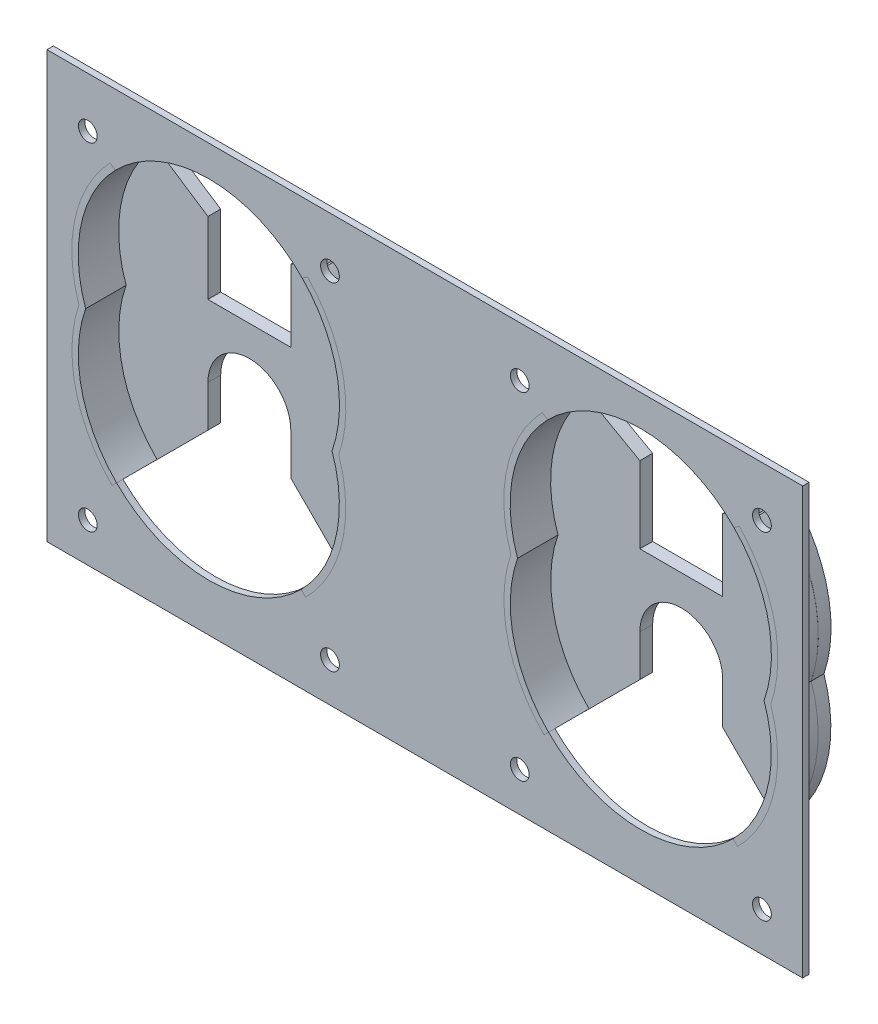
from build123d import *

# Parameters (mm, degrees)
BOSS_EXTRUDE1_DEPTH   = 6.35
BOSS_EXTRUDE1_2_DEPTH = 6.35
BOSS_EXTRUDE1_3_DEPTH = 6.35
BOSS_EXTRUDE1_4_DEPTH = 6.35
SKETCH1_5_W           = 118.584765391
SKETCH1_5_H           = 66.869276247
SKETCH1_5_R           = 1.4732
BOSS_EXTRUDE7_DEPTH   = 1
BOSS_EXTRUDE8_DEPTH   = 2


with BuildPart() as part:
    # Sketch1 → Boss-Extrude1 (new body)
    with BuildSketch(Plane(origin=(0, 0, 24.694917193), x_dir=(-1, 0, 0), z_dir=(0, 0, -1))):
        with BuildLine():
            Line((-27.411403448, -26.627000625), (-26.704296667, -25.919893844))
            ThreePointArc((-26.704296667, -25.919893844), (-32.184721764, -16.013806308), (-31.564428782, -4.709786398))
            ThreePointArc((-31.564428782, -4.709786398), (-32.233619939, 6.549502204), (-26.845726601, 16.458589045))
            Line((-26.845726601, 16.458589045), (-27.696075992, 17.018714539))
            ThreePointArc((-27.696075992, 17.018714539), (-33.192970324, 6.841344605), (-32.620835017, -4.711463161))
            ThreePointArc((-32.620835017, -4.711463161), (-33.119816188, -16.406995999), (-27.411403448, -26.627000625))
        make_face()
    extrude(amount=BOSS_EXTRUDE1_DEPTH)


with BuildPart() as body_2:
    # Sketch1 → Boss-Extrude1 2 (new body)
    with BuildSketch(Plane(origin=(0, 0, 24.694917193), x_dir=(-1, 0, 0), z_dir=(0, 0, -1))):
        with BuildLine():
            ThreePointArc((7.115484162, -4.709786398), (7.735777145, -16.013806308), (2.255352047, -25.919893844))
            Line((2.255352047, -25.919893844), (2.962458828, -26.627000625))
            ThreePointArc((2.962458828, -26.627000625), (8.670871569, -16.406995999), (8.171890397, -4.711463161))
            ThreePointArc((8.171890397, -4.711463161), (8.744025704, 6.841344604), (3.247131374, 17.018714539))
            Line((3.247131374, 17.018714539), (2.396781982, 16.458589044))
            ThreePointArc((2.396781982, 16.458589044), (7.78467532, 6.549502204), (7.115484162, -4.709786398))
        make_face()
    extrude(amount=BOSS_EXTRUDE1_2_DEPTH)


with BuildPart() as body_3:
    # Sketch1 → Boss-Extrude1 3 (new body)
    with BuildSketch(Plane(origin=(0, 0, 24.694917193), x_dir=(-1, 0, 0), z_dir=(0, 0, -1))):
        with BuildLine():
            Line((40.905080795, 16.480957305), (40.055105354, 17.040836478))
            ThreePointArc((40.055105354, 17.040836478), (34.583953243, 6.863754684), (35.170996775, -4.675824129))
            ThreePointArc((35.170996775, -4.675824129), (34.656423866, -16.390490779), (40.370190726, -26.630171843))
            Line((40.370190726, -26.630171843), (41.077297507, -25.923065062))
            ThreePointArc((41.077297507, -25.923065062), (35.59167816, -15.997342767), (36.227907399, -4.674481156))
            ThreePointArc((36.227907399, -4.674481156), (35.543366543, 6.571609557), (40.905080795, 16.480957305))
        make_face()
    extrude(amount=BOSS_EXTRUDE1_3_DEPTH)


with BuildPart() as body_4:
    # Sketch1 → Boss-Extrude1 4 (new body)
    with BuildSketch(Plane(origin=(0, 0, 24.694917193), x_dir=(-1, 0, 0), z_dir=(0, 0, -1))):
        with BuildLine():
            Line((71.065480809, 17.040836478), (70.215505368, 16.480957305))
            ThreePointArc((70.215505368, 16.480957305), (75.57721962, 6.571609557), (74.892678764, -4.674481156))
            ThreePointArc((74.892678764, -4.674481156), (75.528908003, -15.997342767), (70.043288656, -25.923065062))
            Line((70.043288656, -25.923065062), (70.750395437, -26.630171843))
            ThreePointArc((70.750395437, -26.630171843), (76.464162297, -16.390490779), (75.949589388, -4.675824129))
            ThreePointArc((75.949589388, -4.675824129), (76.536632919, 6.863754684), (71.065480809, 17.040836478))
        make_face()
    extrude(amount=BOSS_EXTRUDE1_4_DEPTH)


    add(body_3.part)  # Boss-Extrude8 merges body 3

    add(body_2.part)  # Boss-Extrude8 merges body 2
    # Sketch4 → Boss-Extrude8 (add)
    with BuildSketch(Plane(origin=(0, 0, 18.344917193), x_dir=(-1, 0, 0), z_dir=(0, 0, -1))):
        with BuildLine():
            ThreePointArc((35.170996775, -4.675824129), (34.656359811, -16.39022029), (40.369797621, -26.629778728))
            Line((40.369797621, -26.629778728), (49.051264407, -17.948639189))
            Line((49.051264407, -17.948639189), (49.051264407, -11.448944696))
            ThreePointArc((49.051264407, -11.448944696), (55.551264423, -4.948944679), (62.05126444, -11.448944696))
            Line((62.05126444, -11.448944696), (62.05126444, -17.948882965))
            Line((62.05126444, -17.948882965), (70.741309119, -26.639252729))
            ThreePointArc((70.741309119, -26.639252729), (76.4626812, -16.39674076), (75.949589388, -4.675824129))
            ThreePointArc((75.949589388, -4.675824129), (76.536632919, 6.863754684), (71.065480809, 17.040836478))
            Line((71.065480809, 17.040836478), (62.05126444, 11.103168443))
            Line((62.05126444, 11.103168443), (62.05126444, -0.173638647))
            Line((62.05126444, -0.173638647), (49.051264407, -0.173638647))
            Line((49.051264407, -0.173638647), (49.051264407, 11.115062804))
            Line((49.051264407, 11.115062804), (40.055105354, 17.040836478))
            ThreePointArc((40.055105354, 17.040836478), (34.583953243, 6.863754684), (35.170996775, -4.675824129))
        make_face()
        with BuildLine():
            Line((-18.733020444, -0.17367699), (-18.733020444, 11.114746157))
            Line((-18.733020444, 11.114746157), (-27.716340173, 17.032062564))
            ThreePointArc((-27.716340173, 17.032062564), (-33.206637308, 6.845224023), (-32.621050686, -4.712116951))
            ThreePointArc((-32.621050686, -4.712116951), (-33.119768742, -16.407195595), (-27.411600112, -26.626803958))
            Line((-27.411600112, -26.626803958), (-18.733248921, -17.948677527))
            Line((-18.733248921, -17.948677527), (-18.733248921, -11.448944686))
            ThreePointArc((-18.733248921, -11.448944686), (-12.233248904, -4.948944669), (-5.733248887, -11.448944686))
            Line((-5.733248887, -11.448944686), (-5.733248887, -17.948844627))
            Line((-5.733248887, -17.948844627), (2.953569125, -26.635885128))
            ThreePointArc((2.953569125, -26.635885128), (8.672580304, -16.399802024), (8.163303461, -4.685489272))
            ThreePointArc((8.163303461, -4.685489272), (8.754411469, 6.780844689), (3.360296242, 16.916412955))
            Line((3.360296242, 16.916412955), (-5.73302041, 11.808782641))
            Line((-5.73302041, 11.808782641), (-5.73302041, -0.17384409))
            Line((-5.73302041, -0.17384409), (-18.733020444, -0.17367699))
        make_face()
    extrude(amount=BOSS_EXTRUDE8_DEPTH)


with BuildPart() as body_5:
    # Sketch1<5> → Boss-Extrude7 (new body)
    with BuildSketch(Plane(origin=(0, 0, 24.694917193), x_dir=(-1, 0, 0), z_dir=(0, 0, -1))):
        with Locations((21.667910386, -5.945431363)):
            Rectangle(SKETCH1_5_W, SKETCH1_5_H)
        with Locations((-31.233446035, -33.224517796)):
            Circle(SKETCH1_5_R, mode=Mode.SUBTRACT)
        with Locations((6.766553887, -33.225006242)):
            Circle(SKETCH1_5_R, mode=Mode.SUBTRACT)
        with Locations((36.550977194, -33.224405729)):
            Circle(SKETCH1_5_R, mode=Mode.SUBTRACT)
        with Locations((74.550977113, -33.225118305)):
            Circle(SKETCH1_5_R, mode=Mode.SUBTRACT)
        with BuildLine():
            ThreePointArc((2.255352047, -25.919893844), (-12.22447231, -31.917633473), (-26.704296667, -25.919893844))
            Line((-26.704296667, -25.919893844), (-27.411403448, -26.627000625))
            ThreePointArc((-27.411403448, -26.627000625), (-33.119816188, -16.406995999), (-32.620835017, -4.711463161))
            ThreePointArc((-32.620835017, -4.711463161), (-33.192970324, 6.841344605), (-27.696075992, 17.018714539))
            Line((-27.696075992, 17.018714539), (-26.845726601, 16.458589045))
            ThreePointArc((-26.845726601, 16.458589045), (-12.224472309, 22.589456132), (2.396781982, 16.458589044))
            Line((2.396781982, 16.458589044), (3.247131374, 17.018714539))
            ThreePointArc((3.247131374, 17.018714539), (8.744025704, 6.841344604), (8.171890397, -4.711463161))
            ThreePointArc((8.171890397, -4.711463161), (8.670871569, -16.406995999), (2.962458828, -26.627000625))
            Line((2.962458828, -26.627000625), (2.255352047, -25.919893844))
        make_face(mode=Mode.SUBTRACT)
        with Locations((-31.232766774, 19.620482705)):
            Circle(SKETCH1_5_R, mode=Mode.SUBTRACT)
        with Locations((6.767233148, 19.619994259)):
            Circle(SKETCH1_5_R, mode=Mode.SUBTRACT)
        with BuildLine():
            ThreePointArc((35.170996775, -4.675824129), (34.583953243, 6.863754684), (40.055105354, 17.040836478))
            Line((40.055105354, 17.040836478), (40.905080795, 16.480957305))
            ThreePointArc((40.905080795, 16.480957305), (55.560293081, 22.646439997), (70.215505368, 16.480957305))
            Line((70.215505368, 16.480957305), (71.065480809, 17.040836478))
            ThreePointArc((71.065480809, 17.040836478), (76.536632919, 6.863754684), (75.949589388, -4.675824129))
            ThreePointArc((75.949589388, -4.675824129), (76.464162297, -16.390490779), (70.750395437, -26.630171843))
            Line((70.750395437, -26.630171843), (70.043288656, -25.923065062))
            ThreePointArc((70.043288656, -25.923065062), (55.560293081, -31.922118252), (41.077297507, -25.923065062))
            Line((41.077297507, -25.923065062), (40.370190726, -26.630171843))
            ThreePointArc((40.370190726, -26.630171843), (34.656423866, -16.390490779), (35.170996775, -4.675824129))
        make_face(mode=Mode.SUBTRACT)
        with Locations((36.551968143, 19.620594767)):
            Circle(SKETCH1_5_R, mode=Mode.SUBTRACT)
        with Locations((74.551968061, 19.619882191)):
            Circle(SKETCH1_5_R, mode=Mode.SUBTRACT)
    extrude(amount=BOSS_EXTRUDE7_DEPTH)


solid = Compound([part.part, body_4.part, body_5.part])
